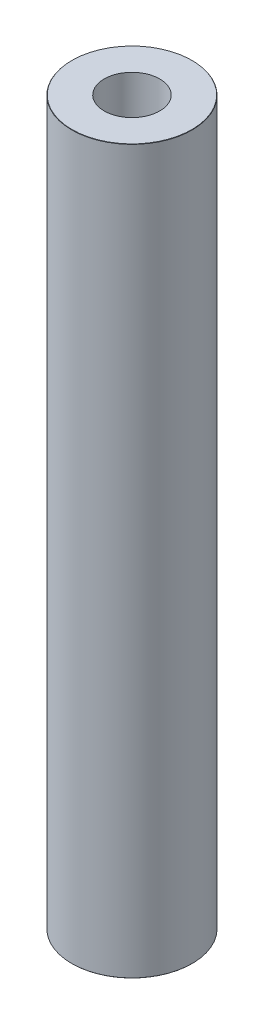
from build123d import *

# Parameters (mm, degrees)
SKETCH1_R           = 50
BOSS_EXTRUDE1_DEPTH = 600
SKETCH2_R           = 23.067356387
CUT_EXTRUDE1_DEPTH  = 605.15229868
CHAMFER1_SIZE       = 0.20235445


with BuildPart() as part:
    # Sketch1 → Boss-Extrude1 (new body)
    with BuildSketch(Plane(origin=(0, 0, 0), x_dir=(1, 0, 0), z_dir=(0, 1, 0))):
        Circle(SKETCH1_R)
    extrude(amount=BOSS_EXTRUDE1_DEPTH)

    # Sketch2 → Cut-Extrude1 (cut, through all)
    with BuildSketch(Plane(origin=(0, 0, 0), x_dir=(1, 0, 0), z_dir=(0, 1, 0))):
        Circle(SKETCH2_R)
    extrude(amount=CUT_EXTRUDE1_DEPTH, mode=Mode.SUBTRACT)

    # Chamfer1
    chamfer1_edges = [part.edges().sort_by_distance(p)[0] for p in [
        (-50, 600, 0),
        (-50, 0, 0),
    ]]
    chamfer(chamfer1_edges, length=CHAMFER1_SIZE)


solid = part.part
